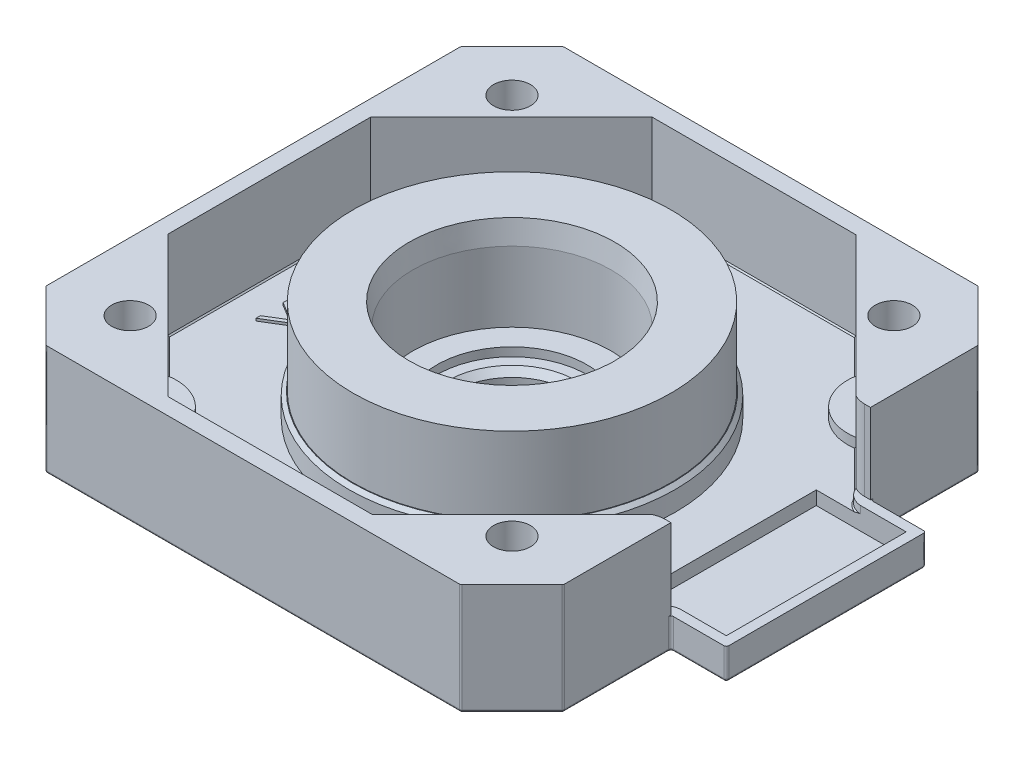
from build123d import *

# Parameters (mm, degrees)
RESSALTO_EXTRUS_O1_DEPTH = 4.5
ESBO_O2_W                = 4.5
ESBO_O2_H                = 16.2
RESSALTO_EXTRUS_O2_DEPTH = 2.5
ESBO_O3_R                = 1.5
CORTE_EXTRUS_O1_DEPTH    = 35.238136632
ESBO_O4_R                = 3.25
CORTE_EXTRUS_O2_DEPTH    = 2.5
CORTE_EXTRUS_O3_DEPTH    = 6.4
FILETE2_R                = 2
CORTE_EXTRUS_O13_DEPTH   = 0.1
CORTE_EXTRUS_O14_DEPTH   = 0.7
RESSALTO_EXTRUS_O3_START = 0.7
RESSALTO_EXTRUS_O3_DEPTH = 0.7
CORTE_EXTRUS_O15_DEPTH   = 1.1
ESBO_O11_R               = 4.75
CORTE_EXTRUS_O16_DEPTH   = 34.809614017
CHANFRO1_SIZE            = 0.5
FILETE3_R                = 0.5
FILETE4_R                = 0.2
CHANFRO2_SIZE            = 0.1
ESBO_O12_R               = 13.25
ESBO_O12_R_2             = 8.05
RESSALTO_EXTRUS_O4_DEPTH = 8.2
CORTE_EXTRUS_O17_START   = -6.3
ESBO_O13_R               = 13.25
ESBO_O13_R_2             = 12.9
CORTE_EXTRUS_O17_DEPTH   = 6.3
CHANFRO3_SIZE            = 0.3
ESBO_O14_R               = 8.05
ESBO_O14_R_2             = 6.1
RESSALTO_EXTRUS_O5_DEPTH = 0.7
CHANFRO4_SIZE            = 0.3
CHANFRO4_SIZE2           = 1.8
RESSALTO_EXTRUS_O6_DEPTH = 0.2


with BuildPart() as part:
    # Esboço1 → Ressalto-extrusão1 (new, symmetric)
    with BuildSketch(Plane(origin=(0, 0, 0), x_dir=(1, 0, 0), z_dir=(0, 1, 0))):
        Polygon((-16.83, -21), (16.83, -21), (21, -16.83), (21, 16.83), (16.83, 21), (-16.83, 21), (-21, 16.83), (-21, -16.83), align=None)
    extrude(amount=RESSALTO_EXTRUS_O1_DEPTH, both=True)


with BuildPart() as body_2:
    # Esboço2 → Ressalto-extrusão2 (new body)
    with BuildSketch(Plane.XZ.offset(4.5)):
        with Locations((23.25, 0)):
            Rectangle(ESBO_O2_W, ESBO_O2_H)
    extrude(amount=-RESSALTO_EXTRUS_O2_DEPTH)


with BuildPart() as part_1:
    add(part.part)

    # Combinar1: union body 2
    add(body_2.part)

    # Esboço3 → Corte-extrusão1 (cut, through all)
    with BuildSketch(Plane(origin=(0, 4.5, 0), x_dir=(1, 0, 0), z_dir=(0, 1, 0))):
        with Locations(Location((-15.5, 15.5, 0), (0, 0, 270))):
            Circle(ESBO_O3_R)
        with Locations(Location((15.5, 15.5, 0), (0, 0, 270))):
            Circle(ESBO_O3_R)
        with Locations(Location((-15.5, -15.5, 0), (0, 0, 270))):
            Circle(ESBO_O3_R)
        with Locations(Location((15.5, -15.5, 0), (0, 0, 270))):
            Circle(ESBO_O3_R)
    extrude(amount=-CORTE_EXTRUS_O1_DEPTH, mode=Mode.SUBTRACT)

    # Esboço4 → Corte-extrusão2 (cut)
    with BuildSketch(Plane.XZ.offset(4.5)):
        with Locations(Location((-15.5, 15.5, 0), (0, 0, 270))):
            Circle(ESBO_O4_R)
        with Locations(Location((15.5, 15.5, 0), (0, 0, 270))):
            Circle(ESBO_O4_R)
        with Locations(Location((15.5, -15.5, 0), (0, 0, 270))):
            Circle(ESBO_O4_R)
        with Locations(Location((-15.5, -15.5, 0), (0, 0, 270))):
            Circle(ESBO_O4_R)
    extrude(amount=-CORTE_EXTRUS_O2_DEPTH, mode=Mode.SUBTRACT)

    # Esboço5 → Corte-extrusão3 (cut)
    with BuildSketch(Plane(origin=(0, 4.5, 0), x_dir=(1, 0, 0), z_dir=(0, 1, 0))):
        Polygon((-19.7, 8.230505063), (-8.280505063, 19.65), (8.280505063, 19.65), (19.6, 8.330505063), (19.6, 8.1), (21, 8.1), (25.5, 8.1), (25.5, -8.1), (21, -8.1), (19.6, -8.1), (19.6, -8.330505063), (8.280505063, -19.65), (-8.280505063, -19.65), (-19.7, -8.230505063), align=None)
    extrude(amount=-CORTE_EXTRUS_O3_DEPTH, mode=Mode.SUBTRACT)

    # Filete2
    # the kernel refuses this fillet: 2 mm, written as the material it takes off along each edge
    with BuildSketch(Plane(origin=(19.6, 6.830353607, -8.1), x_dir=(1, 0, 0), z_dir=(0, -1, 0))) as filete2_piece_1:
        with BuildLine():
            CenterArc((0.932141443, -2), FILETE2_R, 90, 27.77953933)
            Line((0, -0.230505063), (0, 0))
            Line((0, 0), (0.932141443, 0))
        make_face()
    extrude(amount=8.730353607, mode=Mode.SUBTRACT)
    with BuildSketch(Plane(origin=(19.6, 6.830353607, 8.1), x_dir=(0, 0, 1), z_dir=(0, -1, 0))) as filete2_piece_2:
        with BuildLine():
            CenterArc((2, -0.932141443), FILETE2_R, 152.22046067, 27.77953933)
            Line((0, -0.932141443), (0, 0))
            Line((0, 0), (0.230505063, 0))
        make_face()
    extrude(amount=8.730353607, mode=Mode.SUBTRACT)

    # Esboço7 → Corte-extrusão13 (cut)
    with BuildSketch(Plane(origin=(0, -1.9, 0), x_dir=(1, 0, 0), z_dir=(0, 1, 0))):
        with BuildLine():
            Line((-19.7, 8.230505063), (-19.7, -8.230505063))
            Line((-19.7, -8.230505063), (-16.127612402, -11.802892661))
            ThreePointArc((-16.127612402, -11.802892661), (-12.848349571, -12.848349571), (-11.802892661, -16.127612402))
            Line((-11.802892661, -16.127612402), (-8.280505063, -19.65))
            Line((-8.280505063, -19.65), (8.280505063, -19.65))
            Line((8.280505063, -19.65), (11.802892661, -16.127612402))
            ThreePointArc((11.802892661, -16.127612402), (12.848349571, -12.848349571), (16.127612402, -11.802892661))
            Line((16.127612402, -11.802892661), (19.6, -8.330505063))
            ThreePointArc((19.6, -8.330505063), (20.052032014, -8.158481281), (20.532141443, -8.1))
            Line((20.532141443, -8.1), (21, -8.1))
            Line((21, -8.1), (21, 8.1))
            Line((21, 8.1), (20.532141443, 8.1))
            ThreePointArc((20.532141443, 8.1), (20.052032014, 8.158481281), (19.6, 8.330505063))
            Line((19.6, 8.330505063), (16.127612402, 11.802892661))
            ThreePointArc((16.127612402, 11.802892661), (12.848349571, 12.848349571), (11.802892661, 16.127612402))
            Line((11.802892661, 16.127612402), (8.280505063, 19.65))
            Line((8.280505063, 19.65), (-8.280505063, 19.65))
            Line((-8.280505063, 19.65), (-11.802892661, 16.127612402))
            ThreePointArc((-11.802892661, 16.127612402), (-12.848349571, 12.848349571), (-16.127612402, 11.802892661))
            Line((-16.127612402, 11.802892661), (-19.7, 8.230505063))
        make_face()
    extrude(amount=-CORTE_EXTRUS_O13_DEPTH, mode=Mode.SUBTRACT)

    # Esboço8 → Corte-extrusão14 (cut)
    with BuildSketch(Plane(origin=(0, -2, 0), x_dir=(1, 0, 0), z_dir=(0, 1, 0))):
        with BuildLine():
            Line((25.5, 8.1), (21, 8.1))
            Line((21, 8.1), (20.532141443, 8.1))
            ThreePointArc((20.532141443, 8.1), (20.052032014, 8.158481281), (19.6, 8.330505063))
            Line((19.6, 8.330505063), (16.127612402, 11.802892661))
            ThreePointArc((16.127612402, 11.802892661), (12.848349571, 12.848349571), (11.802892661, 16.127612402))
            Line((11.802892661, 16.127612402), (8.280505063, 19.65))
            Line((8.280505063, 19.65), (-8.280505063, 19.65))
            Line((-8.280505063, 19.65), (-11.802892661, 16.127612402))
            ThreePointArc((-11.802892661, 16.127612402), (-12.848349571, 12.848349571), (-16.127612402, 11.802892661))
            Line((-16.127612402, 11.802892661), (-19.7, 8.230505063))
            Line((-19.7, 8.230505063), (-19.7, -8.230505063))
            Line((-19.7, -8.230505063), (-16.127612402, -11.802892661))
            ThreePointArc((-16.127612402, -11.802892661), (-12.848349571, -12.848349571), (-11.802892661, -16.127612402))
            Line((-11.802892661, -16.127612402), (-8.280505063, -19.65))
            Line((-8.280505063, -19.65), (8.280505063, -19.65))
            Line((8.280505063, -19.65), (11.802892661, -16.127612402))
            ThreePointArc((11.802892661, -16.127612402), (12.848349571, -12.848349571), (16.127612402, -11.802892661))
            Line((16.127612402, -11.802892661), (19.6, -8.330505063))
            ThreePointArc((19.6, -8.330505063), (20.052032014, -8.158481281), (20.532141443, -8.1))
            Line((20.532141443, -8.1), (21, -8.1))
            Line((21, -8.1), (25.5, -8.1))
            Line((25.5, -8.1), (25.5, 8.1))
        make_face()
    extrude(amount=-CORTE_EXTRUS_O14_DEPTH, mode=Mode.SUBTRACT)

    # Esboço9 → Ressalto-extrusão3 (add)
    with BuildSketch(Plane(origin=(0, -2.7, 0), x_dir=(1, 0, 0), z_dir=(0, 1, 0)).offset(RESSALTO_EXTRUS_O3_START)):
        with BuildLine():
            Line((25.5, 8.1), (21, 8.1))
            Line((21, 8.1), (20.532141443, 8.1))
            ThreePointArc((20.532141443, 8.1), (20.052032014, 8.158481281), (19.6, 8.330505063))
            ThreePointArc((19.6, 8.330505063), (20.147841827, 7.608536961), (21, 7.3))
            Line((21, 7.3), (24.7, 7.3))
            Line((24.7, 7.3), (24.7, -7.3))
            Line((24.7, -7.3), (21, -7.3))
            ThreePointArc((21, -7.3), (20.147841827, -7.608536961), (19.6, -8.330505063))
            ThreePointArc((19.6, -8.330505063), (20.052032014, -8.158481281), (20.532141443, -8.1))
            Line((20.532141443, -8.1), (21, -8.1))
            Line((21, -8.1), (25.5, -8.1))
            Line((25.5, -8.1), (25.5, 8.1))
        make_face()
    extrude(amount=-RESSALTO_EXTRUS_O3_DEPTH)

    # Esboço10 → Corte-extrusão15 (cut)
    with BuildSketch(Plane(origin=(0, -2.7, 0), x_dir=(1, 0, 0), z_dir=(0, 1, 0))):
        Polygon((21, 7.3), (24.7, 7.3), (24.7, -7.3), (21, -7.3), (17.4, -7.3), (17.4, 7.3), align=None)
    extrude(amount=-CORTE_EXTRUS_O15_DEPTH, mode=Mode.SUBTRACT)

    # Esboço11 → Corte-extrusão16 (cut, through all)
    with BuildSketch(Plane(origin=(0, -2.7, 0), x_dir=(1, 0, 0), z_dir=(0, 1, 0))):
        with Locations(Location((0, 0, 0), (0, 0, 270))):
            Circle(ESBO_O11_R)
    extrude(amount=-CORTE_EXTRUS_O16_DEPTH, mode=Mode.SUBTRACT)

    # Chanfro1
    chanfro1_edges = [part_1.edges().sort_by_distance(p)[0] for p in [
        (0, -2.7, -4.75),
    ]]
    chamfer(chanfro1_edges, length=CHANFRO1_SIZE)

    # Filete3
    filete3_edges = [part_1.edges().sort_by_distance(p)[0] for p in [
        (0, -4.5, -4.75),
    ]]
    fillet(filete3_edges, radius=FILETE3_R)

    # Filete4
    filete4_edges = [part_1.edges().sort_by_distance(p)[0] for p in [
        (18.915, -4.5, -18.915),
        (0, -4.5, -21),
        (-18.915, -4.5, -18.915),
        (-21, -4.5, 0),
        (-21, 0, 16.83),
        (-16.83, 0, 21),
        (16.83, 0, 21),
        (21, 0, 16.83),
        (21, 0, -16.83),
        (16.83, 0, -21),
        (-16.83, 0, -21),
        (-21, 0, -16.83),
        (25.5, -3.25, -8.1),
        (25.5, -3.25, 8.1),
        (21, -3.25, 8.1),
        (21, -3.25, -8.1),
        (21, -4.5, -12.465),
        (23.25, -4.5, 8.1),
        (23.25, -4.5, -8.1),
        (25.5, -4.5, 0),
        (-15.5, -4.5, -12.25),
        (15.5, -4.5, -12.25),
        (15.5, -4.5, 18.75),
        (-18.915, -4.5, 18.915),
        (-15.5, -4.5, 18.75),
        (0, -4.5, 21),
        (18.915, -4.5, 18.915),
        (21, -4.5, 12.465),
    ]]
    fillet(filete4_edges, radius=FILETE4_R)

    # Chanfro2
    # the kernel refuses this chamfer: 0.1 mm, written as the material it adds along each edge
    with BuildSketch(Plane(origin=(15.945766954, -2.7, 11.984738109), x_dir=(0, 1, 0), z_dir=(0.707106781186547, 0, -0.7071067811865481)), Plane(origin=(19.909137262, -2.7, -8.021367802), x_dir=(0, 1, 0), z_dir=(-0.7071067811865476, 0, -0.7071067811865476))) as chanfro2_piece_1:
        Polygon((CHANFRO2_SIZE, 0), (0, -CHANFRO2_SIZE), (0, 0), align=None)
    extrude(amount=5.605052042)
    with BuildSketch(Plane(origin=(8.098659615, -2.7, 19.831845448), x_dir=(0, 1, 0), z_dir=(0.7071067811865476, 0, -0.7071067811865476)), Plane(origin=(-11.984738109, -2.7, 15.945766954), x_dir=(0, 1, 0), z_dir=(0.7071067811865476, 0, 0.7071067811865476)), Plane(origin=(-8.098659615, -2.7, -19.831845448), x_dir=(0, 1, 0), z_dir=(-0.707106781186547, 0, 0.7071067811865481)), Plane(origin=(11.984738109, -2.7, -15.945766954), x_dir=(0, 1, 0), z_dir=(-0.7071067811865477, 0, -0.7071067811865474))) as chanfro2_piece_2:
        Polygon((CHANFRO2_SIZE, 0), (0, -CHANFRO2_SIZE), (0, 0), align=None)
    extrude(amount=5.495744911)
    with BuildSketch(Plane(origin=(-8.537673362, -2.7, 19.65), x_dir=(0, 1, 0), z_dir=(1, 0, 0)), Plane(origin=(8.537673362, -2.7, -19.65), x_dir=(0, 1, 0), z_dir=(-1, 0, 0))) as chanfro2_piece_3:
        Polygon((CHANFRO2_SIZE, 0), (0, -CHANFRO2_SIZE), (0, 0), align=None)
    extrude(amount=17.075346724)
    with BuildSketch(Plane(origin=(-19.881845448, -2.7, 8.048659615), x_dir=(0, 1, 0), z_dir=(0.707106781186548, 0, 0.707106781186547)), Plane(origin=(-15.945766954, -2.7, -11.984738109), x_dir=(0, 1, 0), z_dir=(-0.7071067811865477, 0, 0.7071067811865474))) as chanfro2_piece_4:
        Polygon((CHANFRO2_SIZE, 0), (0, -CHANFRO2_SIZE), (0, 0), align=None)
    extrude(amount=5.566455589)
    with BuildSketch(Plane(origin=(-19.7, -2.7, -8.487673362), x_dir=(0, 1, 0), z_dir=(0, 0, 1))) as chanfro2_piece_5:
        Polygon((CHANFRO2_SIZE, 0), (0, -CHANFRO2_SIZE), (0, 0), align=None)
    extrude(amount=16.975346724)
    with BuildSketch(Plane(origin=(21.096319572, -2.7, -8.897098162), x_dir=(-0.9798256795099388, 0, 0.19985404117226796), z_dir=(-0.19985404117226796, 0, -0.9798256795099388))) as chanfro2_piece_6_section:
        Polygon((1.6, CHANFRO2_SIZE), (1.6 + CHANFRO2_SIZE, 0), (1.6, 0), align=None)
    chanfro2_piece_6 = revolve(axis=Axis((21.096319572, -2.7, -8.897098162), (0, 1, 0)), revolution_arc=102.653715944, mode=Mode.PRIVATE)
    chanfro2_piece_6 = split(chanfro2_piece_6, bisect_by=Plane(origin=(21.096319572, -2.7, -7.3), z_dir=(0, 0, -1)), keep=Keep.TOP, mode=Mode.PRIVATE)
    add(chanfro2_piece_6)
    with BuildSketch(Plane(origin=(21.096319572, -2.7, 8.897098162), x_dir=(0.40963868903771855, 0, -0.9122478525288286), z_dir=(0.9122478525288286, 0, 0.40963868903771855))) as chanfro2_piece_7_section:
        Polygon((1.6, CHANFRO2_SIZE), (1.6 + CHANFRO2_SIZE, 0), (1.6, 0), align=None)
    chanfro2_piece_7 = revolve(axis=Axis((21.096319572, -2.7, 8.897098162), (0, 1, 0)), revolution_arc=102.653715944, mode=Mode.PRIVATE)
    chanfro2_piece_7 = split(chanfro2_piece_7, bisect_by=Plane(origin=(21.096319572, -2.7, 7.3), z_dir=(0, 0, 1)), keep=Keep.TOP, mode=Mode.PRIVATE)
    add(chanfro2_piece_7)

    # Esboço12 → Ressalto-extrusão4 (add)
    with BuildSketch(Plane(origin=(0, -2.7, 0), x_dir=(1, 0, 0), z_dir=(0, 1, 0))):
        with Locations(Location((0, 0, 0), (0, 0, 270))):
            Circle(ESBO_O12_R)
        with Locations(Location((0, 0, 0), (0, 0, 270))):
            Circle(ESBO_O12_R_2, mode=Mode.SUBTRACT)
    extrude(amount=RESSALTO_EXTRUS_O4_DEPTH)

    # Esboço13 → Corte-extrusão17 (cut)
    with BuildSketch(Plane(origin=(0, 5.5, 0), x_dir=(1, 0, 0), z_dir=(0, 1, 0)).offset(CORTE_EXTRUS_O17_START)):
        with Locations(Location((0, 0, 0), (0, 0, 270))):
            Circle(ESBO_O13_R)
        with Locations(Location((0, 0, 0), (0, 0, 270))):
            Circle(ESBO_O13_R_2, mode=Mode.SUBTRACT)
    extrude(amount=CORTE_EXTRUS_O17_DEPTH, mode=Mode.SUBTRACT)

    # Chanfro3
    chanfro3_edges = [part_1.edges().sort_by_distance(p)[0] for p in [
        (0, -0.8, -13.25),
    ]]
    chamfer(chanfro3_edges, length=CHANFRO3_SIZE)

    # Esboço14 → Ressalto-extrusão5 (add)
    with BuildSketch(Plane(origin=(0, -2.7, 0), x_dir=(1, 0, 0), z_dir=(0, 1, 0))):
        with Locations(Location((0, 0, 0), (0, 0, 270))):
            Circle(ESBO_O14_R)
        with Locations(Location((0, 0, 0), (0, 0, 270))):
            Circle(ESBO_O14_R_2, mode=Mode.SUBTRACT)
    extrude(amount=RESSALTO_EXTRUS_O5_DEPTH)

    # Chanfro4
    chanfro4_edges = [part_1.edges().sort_by_distance(p)[0] for p in [
        (0, 5.5, -8.05),
    ]]
    chanfro4_side = [part_1.faces().sort_by_distance(p)[0] for p in [
        (0, 5.5, -12.535132901),
    ]]
    chamfer(chanfro4_edges, length=CHANFRO4_SIZE, length2=CHANFRO4_SIZE2, reference=chanfro4_side[0])

    # Esboço15 → Ressalto-extrusão6 (add)
    with BuildSketch(Plane(origin=(0, -2.7, 0), x_dir=(1, 0, 0), z_dir=(0, 1, 0))):
        with BuildLine():
            Line((-0.746260684, -17.556401251), (-0.746260684, -17.285033729))
            Line((-0.746260684, -17.285033729), (0.15370426, -17.285033729))
            Line((0.15370426, -17.285033729), (0.296278212, -16.589124441))
            add(Edge.make_bspline(
                [(0.296278212, -16.589124441), (0.268265735, -16.596858039), (0.213995993, -16.611840663), (0.133895383, -16.628475977), (0.057852468, -16.638504022), (0.008507396, -16.639873286), (-0.015370426, -16.640535866)],
                knots=[0, 0, 0, 0, 1.100273476, 2.13160584, 3.095893838, 4, 4, 4, 4], degree=3))
            add(Edge.make_bspline(
                [(-0.015370426, -16.640535866), (-0.044921193, -16.63991733), (-0.103025385, -16.638701135), (-0.187908423, -16.626335255), (-0.269339896, -16.608412191), (-0.346148522, -16.580843098), (-0.419572614, -16.54695934), (-0.488616723, -16.504835926), (-0.553605172, -16.455073094), (-0.614395909, -16.398691665), (-0.669200893, -16.33591712), (-0.717015298, -16.268366103), (-0.757885149, -16.196792382), (-0.790487186, -16.120537602), (-0.816920309, -16.04032038), (-0.834397921, -15.955467608), (-0.846058909, -15.866685266), (-0.847360021, -15.80597844), (-0.848023504, -15.775021877)],
                knots=[0, 0, 0, 0, 1.052656913, 2.069786496, 3.052102726, 4.020122636, 4.972424848, 5.930457368, 6.896570172, 7.885826804, 8.881139003, 9.861434336, 10.831623367, 11.813212553, 12.812997731, 13.836986694, 14.897002833, 16, 16, 16, 16], degree=3))
            add(Edge.make_bspline(
                [(-0.848023504, -15.775021877), (-0.847520354, -15.753460543), (-0.846520853, -15.710629258), (-0.841447567, -15.647018689), (-0.831647775, -15.584762113), (-0.818631709, -15.523982848), (-0.801324013, -15.464590187), (-0.780856804, -15.406444001), (-0.756358934, -15.349640483), (-0.728403513, -15.294462284), (-0.696597574, -15.241995451), (-0.662653491, -15.191628632), (-0.62566622, -15.144823021), (-0.586283251, -15.100796253), (-0.543748392, -15.060814616), (-0.499105452, -15.023210258), (-0.451356127, -14.989578231), (-0.401342198, -14.958646416), (-0.349098751, -14.930950727), (-0.294095087, -14.907847714), (-0.237538939, -14.887597685), (-0.178926158, -14.871130264), (-0.118370314, -14.858353922), (-0.055662873, -14.849653408), (0.008881509, -14.843323026), (0.052632172, -14.842926391), (0.074732071, -14.842726037)],
                knots=[0, 0, 0, 0, 1.056281413, 2.098288097, 3.122646807, 4.141030392, 5.140675379, 6.150604744, 7.15845591, 8.168533554, 9.177684096, 10.161739049, 11.141561652, 12.097360316, 13.052218386, 13.998410789, 14.954052752, 15.909851415, 16.877523809, 17.846742625, 18.829312613, 19.818263486, 20.826374662, 21.858017533, 22.918014209, 24, 24, 24, 24], degree=3))
            add(Edge.make_bspline(
                [(0.074732071, -14.842726037), (0.101094586, -14.843249728), (0.15295972, -14.844280029), (0.228958533, -14.855007849), (0.302033466, -14.87047751), (0.371881443, -14.893384351), (0.438173991, -14.923422983), (0.501872748, -14.958883838), (0.56181171, -15.001683685), (0.618416114, -15.050288168), (0.670341102, -15.104196634), (0.718143902, -15.161509445), (0.759535139, -15.223497778), (0.79550004, -15.289127471), (0.826094547, -15.358569621), (0.850150699, -15.431985408), (0.869560795, -15.509018213), (0.877773233, -15.562050753), (0.881944444, -15.588986721)],
                knots=[0, 0, 0, 0, 1.04695683, 2.059763882, 3.044413726, 4.012427942, 4.974081556, 5.932886124, 6.904940154, 7.895678616, 8.893654631, 9.876199664, 10.857615262, 11.850515636, 12.847107701, 13.868396357, 14.917328757, 16, 16, 16, 16], degree=3))
            Line((0.881944444, -15.588986721), (0.644497863, -15.588986721))
            add(Edge.make_bspline(
                [(0.644497863, -15.588986721), (0.638662777, -15.563750648), (0.627447418, -15.515245516), (0.602701408, -15.4471779), (0.572923784, -15.386269176), (0.535873283, -15.332902383), (0.493787882, -15.285281189), (0.445214517, -15.242932946), (0.390565961, -15.205188186), (0.329830008, -15.173468989), (0.265590157, -15.146789312), (0.198748649, -15.127740311), (0.130254606, -15.116211779), (0.084139606, -15.114802289), (0.060951689, -15.114093558)],
                knots=[0, 0, 0, 0, 1.136370375, 2.184166959, 3.172867797, 4.104539607, 5.027679118, 5.956634301, 6.927059835, 7.936867459, 8.959641981, 9.976160943, 10.98235693, 12, 12, 12, 12], degree=3))
            add(Edge.make_bspline(
                [(0.060951689, -15.114093558), (0.038306453, -15.114719219), (-0.006282202, -15.115951149), (-0.071935033, -15.125279986), (-0.135135112, -15.140024859), (-0.195994628, -15.160681581), (-0.254214529, -15.188009213), (-0.309712498, -15.221579634), (-0.363279152, -15.260555292), (-0.413504699, -15.305103047), (-0.459494, -15.354222581), (-0.500131702, -15.406742734), (-0.53398075, -15.46277192), (-0.562505984, -15.521337834), (-0.584166501, -15.58308296), (-0.599618913, -15.64771777), (-0.608692653, -15.715401954), (-0.609940866, -15.761567443), (-0.610576923, -15.785092156)],
                knots=[0, 0, 0, 0, 1.027268864, 2.022700798, 3.002744649, 3.968653148, 4.933396556, 5.915045722, 6.907600446, 7.935526002, 8.956456544, 9.95700807, 10.942805781, 11.92166854, 12.907987664, 13.905483474, 14.932689774, 16, 16, 16, 16], degree=3))
            add(Edge.make_bspline(
                [(-0.610576923, -15.785092156), (-0.61017489, -15.806331468), (-0.60939083, -15.847753115), (-0.600118315, -15.908298096), (-0.587628967, -15.966091618), (-0.567931018, -16.020593694), (-0.544005073, -16.072373323), (-0.512830559, -16.120151094), (-0.478365108, -16.166263145), (-0.437090379, -16.207660932), (-0.392399357, -16.24618845), (-0.342873636, -16.278865203), (-0.289928561, -16.306667035), (-0.233440742, -16.32944232), (-0.173347476, -16.3475855), (-0.109614488, -16.360124265), (-0.042227788, -16.367627333), (0.003866899, -16.368645157), (0.027560764, -16.369168345)],
                knots=[0, 0, 0, 0, 1.045820996, 2.039596555, 3.013371638, 3.9552447, 4.890047302, 5.817684688, 6.761648481, 7.722253242, 8.692244539, 9.66551337, 10.63924952, 11.635311376, 12.662847378, 13.728455105, 14.832366986, 16, 16, 16, 16], degree=3))
            add(Edge.make_bspline(
                [(0.027560764, -16.369168345), (0.04824704, -16.368744349), (0.090595059, -16.367876365), (0.155705066, -16.361045509), (0.223828168, -16.350536894), (0.295228842, -16.335390626), (0.36971114, -16.316426455), (0.447398928, -16.292742584), (0.528294083, -16.265461752), (0.582742314, -16.244301808), (0.610576923, -16.233484584)],
                knots=[0, 0, 0, 0, 0.824638674, 1.688163388, 2.607705698, 3.571998603, 4.597075385, 5.671199175, 6.809488238, 8, 8, 8, 8], degree=3))
            Line((0.610576923, -16.233484584), (0.339209402, -17.556401251))
            Line((0.339209402, -17.556401251), (-0.746260684, -17.556401251))
        make_face()
        Polygon((-17.210310683, -3.568634878), (-17.210310683, -3.208959397), (-15.706404433, -2.289087603), (-17.210310683, -1.370618051), (-17.210310683, -1.010942571), (-15.374072702, -2.132737442), (-13.710310683, -2.132737442), (-13.710310683, -2.446840006), (-15.374072702, -2.446840006), align=None)
        Polygon((-17.210310683, -0.651968212), (-17.210310683, -0.327348821), (-14.643503791, 0.357647173), (-17.210310683, 1.376377141), (-17.210310683, 1.421950058), (-14.661031836, 2.421749737), (-17.210310683, 3.11025134), (-17.210310683, 3.431365122), (-13.710310683, 2.487655186), (-13.710310683, 2.442783391), (-16.387193695, 1.389698455), (-13.710310683, 0.323993327), (-13.710310683, 0.279121532), align=None)
    extrude(amount=RESSALTO_EXTRUS_O6_DEPTH)


solid = part_1.part
